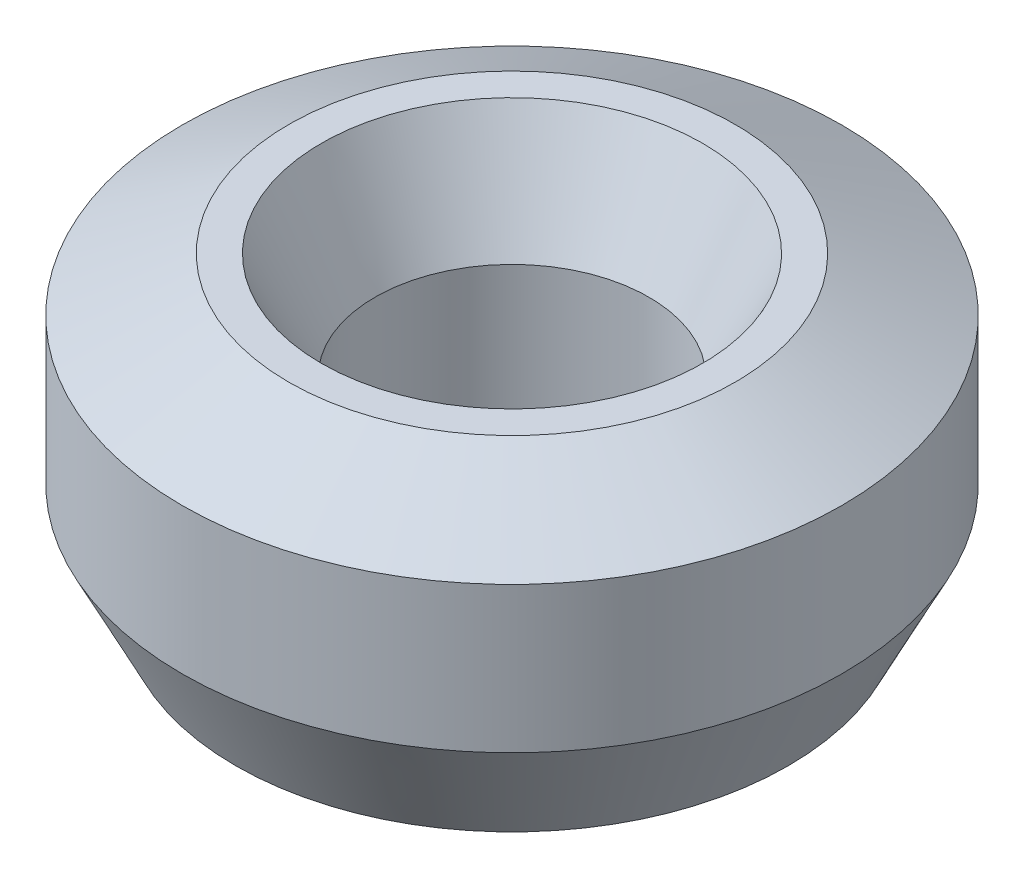
from build123d import *
from OCP.BRepFilletAPI import BRepFilletAPI_MakeChamfer

# Parameters (mm, degrees)
SKETCH1_R           = 17.5
BOSS_EXTRUDE1_DEPTH = 16.237261868
SKETCH2_R           = 7.272160948
CUT_EXTRUDE1_DEPTH  = 30.599808664
CHAMFER1_SIZE       = 2.846579278
CHAMFER1_SIZE2      = 5.650592883


with BuildPart() as part:
    # Sketch1 → Boss-Extrude1 (new body)
    with BuildSketch(Plane(origin=(0, 0, 0), x_dir=(1, 0, 0), z_dir=(0, 1, 0))):
        Circle(SKETCH1_R)
    extrude(amount=BOSS_EXTRUDE1_DEPTH)

    # Sketch2 → Cut-Extrude1 (cut, through all)
    with BuildSketch(Plane(origin=(0, 0, 0), x_dir=(1, 0, 0), z_dir=(0, 1, 0))):
        Circle(SKETCH2_R)
    extrude(amount=CUT_EXTRUDE1_DEPTH, mode=Mode.SUBTRACT)

    # Chamfer1: one chamfer whose edges measure the first distance from different faces: ONE call of the kernel's chamfer builder (chamfer() names one face for all edges)
    chamfer1_edges_1 = [part.edges().sort_by_distance(p)[0] for p in [
        (-7.272160948, 16.237261868, 0),
    ]]
    chamfer1_side_1 = [part.faces().sort_by_distance(p)[0] for p in [
        (-17.005025253, 16.237261868, 0),
    ]]
    chamfer1_edges_2 = [part.edges().sort_by_distance(p)[0] for p in [
        (-7.272160948, 0, 0),
    ]]
    chamfer1_side_2 = [part.faces().sort_by_distance(p)[0] for p in [
        (-7.272160948, 8.118630934, 0),
    ]]
    chamfer1_edges_3 = [part.edges().sort_by_distance(p)[0] for p in [
        (-17.5, 0, 0),
    ]]
    chamfer1_side_3 = [part.faces().sort_by_distance(p)[0] for p in [
        (-17.005025253, 0, 0),
    ]]
    chamfer1_edges_4 = [part.edges().sort_by_distance(p)[0] for p in [
        (-17.5, 16.237261868, 0),
    ]]
    chamfer1_side_4 = [part.faces().sort_by_distance(p)[0] for p in [
        (-17.5, 8.118630934, 0),
    ]]
    chamfer1 = BRepFilletAPI_MakeChamfer(part.part.solid().wrapped)
    for e in chamfer1_edges_1:
        chamfer1.Add(CHAMFER1_SIZE, CHAMFER1_SIZE2, e.wrapped, chamfer1_side_1[0].wrapped)  # the first distance lies on this face
    for e in chamfer1_edges_2:
        chamfer1.Add(CHAMFER1_SIZE, CHAMFER1_SIZE2, e.wrapped, chamfer1_side_2[0].wrapped)  # the first distance lies on this face
    for e in chamfer1_edges_3:
        chamfer1.Add(CHAMFER1_SIZE, CHAMFER1_SIZE2, e.wrapped, chamfer1_side_3[0].wrapped)  # the first distance lies on this face
    for e in chamfer1_edges_4:
        chamfer1.Add(CHAMFER1_SIZE, CHAMFER1_SIZE2, e.wrapped, chamfer1_side_4[0].wrapped)  # the first distance lies on this face
    add(Compound.cast(chamfer1.Shape()), mode=Mode.REPLACE)


solid = part.part
